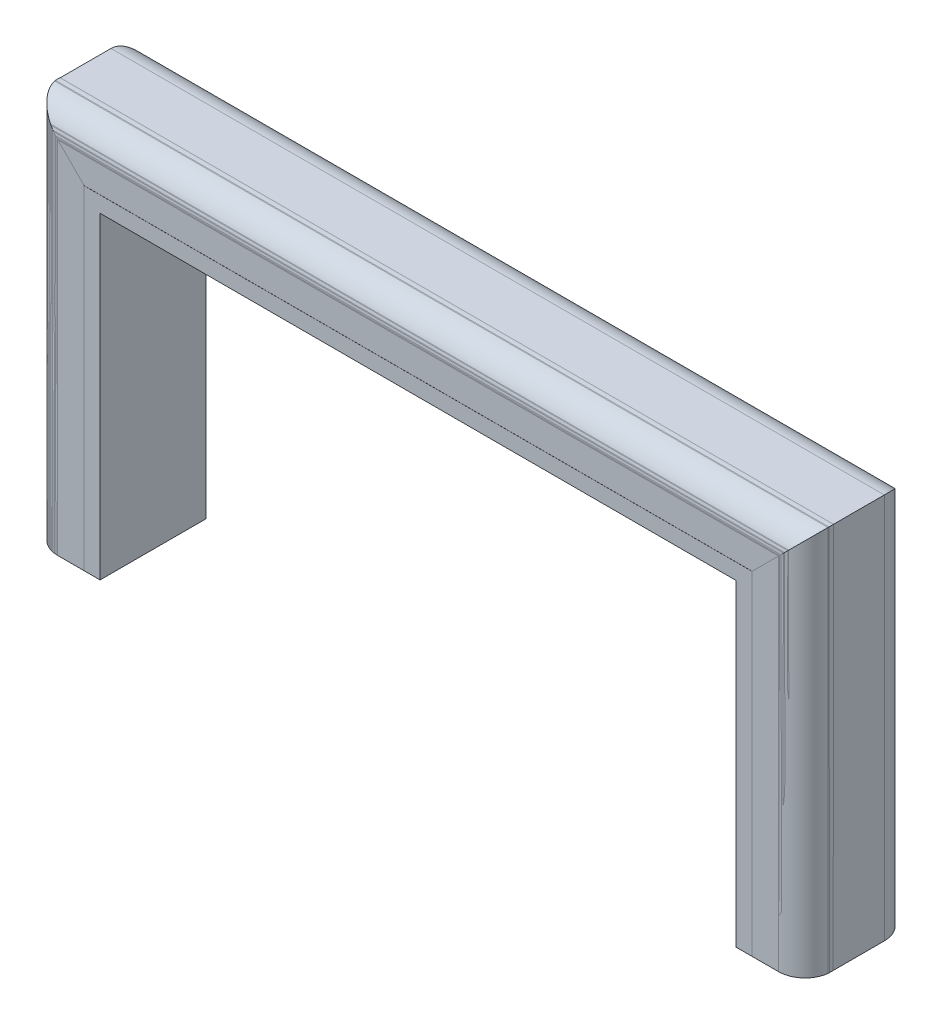
from build123d import *

# Parameters (mm, degrees)
PLYWOOD_DEPTH = 127
SKETCH2_R     = 31.75
SKETCH2_R_2   = 31.623


with BuildPart() as part:
    # Sketch1 → Plywood (new body)
    with BuildSketch(Plane.XY):
        Polygon((-400.600500042, 0), (-400.600500042, 400.05), (400.600500042, 400.05), (400.600500042, 0), (381.550500042, 0), (381.550500042, 381), (-381.550500042, 381), (-381.550500042, 0), align=None)
    extrude(amount=PLYWOOD_DEPTH)


with BuildPart() as body_2:
    # Sweep1: sweep along a path in Sketch3
    with BuildLine(Plane.XY.offset(95.25)) as sweep1_path:
        Line((-432.350500042, 0), (-432.350500042, 431.8))
        Line((-432.350500042, 431.8), (432.350500042, 431.8))
        Line((432.350500042, 431.8), (432.350500042, 0))
    # Sketch2 → Sweep1 (sweep)
    with BuildSketch(Plane.XZ):
        with Locations((-432.350500042, 95.25)):
            Circle(SKETCH2_R)
        with Locations((-432.223500042, 31.623)):
            Circle(SKETCH2_R_2)
    sweep(path=sweep1_path.line, transition=Transition.RIGHT)


with BuildPart() as body_3:
    # Sweep2: sweep along a path in Sketch4
    with BuildLine(Plane.XY.offset(31.623)) as sweep2_path:
        Line((-432.223500042, 0), (-432.223500042, 431.8))
        Line((-432.223500042, 431.8), (432.350500042, 431.8))
        Line((432.350500042, 431.8), (432.350500042, 0))
    # Sketch6 → Sweep2 (sweep)
    with BuildSketch(Plane.XZ):
        with BuildLine():
            Line((-432.223500042, 0), (-400.600500042, 0))
            Line((-400.600500042, 0), (-400.600500042, 127))
            Line((-400.600500042, 127), (-432.350500042, 127))
            ThreePointArc((-432.350500042, 127), (-453.336290907, 119.075597196), (-463.846500042, 99.258052395))
            Line((-463.846500042, 99.258052395), (-463.846500042, 91.241947605))
            Line((-463.846500042, 91.241947605), (-463.846500042, 31.623))
            ThreePointArc((-463.846500042, 31.623), (-454.584337783, 9.262162259), (-432.223500042, 0))
        make_face()
    sweep(path=sweep2_path.line, transition=Transition.RIGHT)


solid = Compound([part.part, body_2.part, body_3.part])
